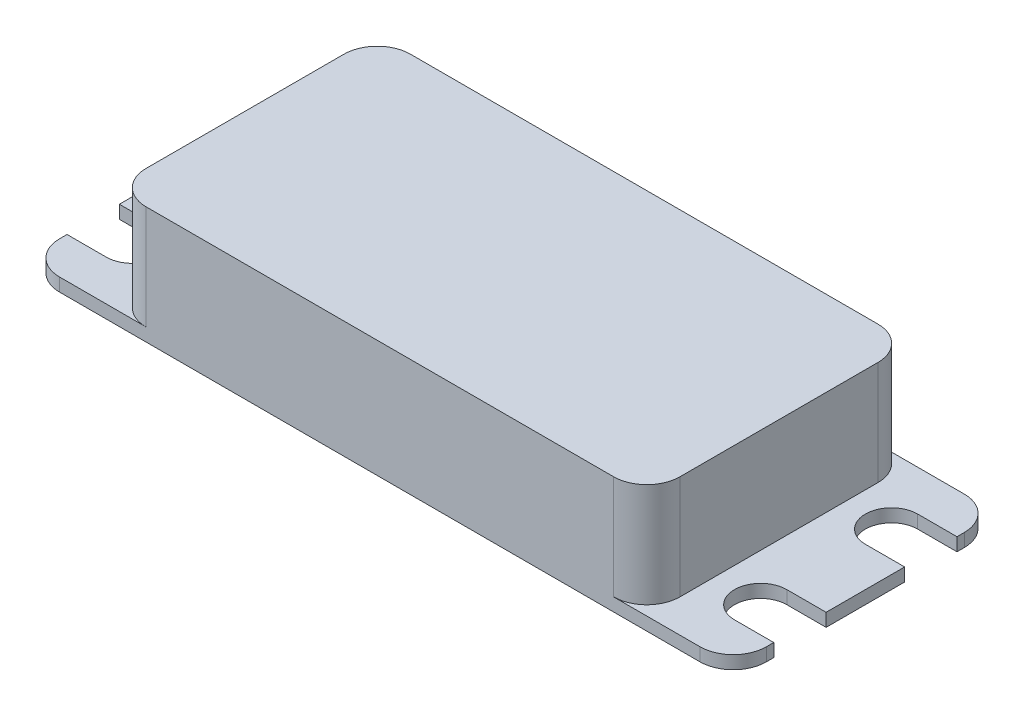
from build123d import *

# Parameters (mm, degrees)
BOSS_EXTRUDE1_DEPTH = 1
BOSS_EXTRUDE2_DEPTH = 7.95


with BuildPart() as part:
    # Sketch1 → Boss-Extrude1 (new body)
    with BuildSketch(Plane(origin=(0, 0, 0), x_dir=(1, 0, 0), z_dir=(0, 1, 0))):
        with BuildLine():
            ThreePointArc((-27, -7.56), (-26.256051224, -9.356051224), (-24.46, -10.1))
            Line((-24.46, -10.1), (24.46, -10.1))
            ThreePointArc((24.46, -10.1), (26.256051224, -9.356051224), (27, -7.56))
            Line((27, -7.56), (27, -7))
            Line((27, -7), (24, -7))
            ThreePointArc((24, -7), (22, -5), (24, -3))
            Line((24, -3), (27, -3))
            Line((27, -3), (27, 3))
            Line((27, 3), (24, 3))
            ThreePointArc((24, 3), (22, 5), (24, 7))
            Line((24, 7), (27, 7))
            Line((27, 7), (27, 7.56))
            ThreePointArc((27, 7.56), (26.256051224, 9.356051224), (24.46, 10.1))
            Line((24.46, 10.1), (-24.46, 10.1))
            ThreePointArc((-24.46, 10.1), (-26.256051224, 9.356051224), (-27, 7.56))
            Line((-27, 7.56), (-27, 7))
            Line((-27, 7), (-24, 7))
            ThreePointArc((-24, 7), (-22, 5), (-24, 3))
            Line((-24, 3), (-27, 3))
            Line((-27, 3), (-27, -3))
            Line((-27, -3), (-24, -3))
            ThreePointArc((-24, -3), (-22, -5), (-24, -7))
            Line((-24, -7), (-27, -7))
            Line((-27, -7), (-27, -7.56))
        make_face()
    extrude(amount=BOSS_EXTRUDE1_DEPTH)

    # Sketch3 → Boss-Extrude2 (add)
    with BuildSketch(Plane(origin=(0, 1, 0), x_dir=(1, 0, 0), z_dir=(0, 1, 0))):
        with BuildLine():
            Line((-17.86, -10.1), (17.86, -10.1))
            ThreePointArc((17.86, -10.1), (19.656051224, -9.356051224), (20.4, -7.56))
            Line((20.4, -7.56), (20.4, 7.56))
            ThreePointArc((20.4, 7.56), (19.656051224, 9.356051224), (17.86, 10.1))
            Line((17.86, 10.1), (-17.86, 10.1))
            ThreePointArc((-17.86, 10.1), (-19.656051224, 9.356051224), (-20.4, 7.56))
            Line((-20.4, 7.56), (-20.4, -7.56))
            ThreePointArc((-20.4, -7.56), (-19.656051224, -9.356051224), (-17.86, -10.1))
        make_face()
    extrude(amount=BOSS_EXTRUDE2_DEPTH)


solid = part.part
